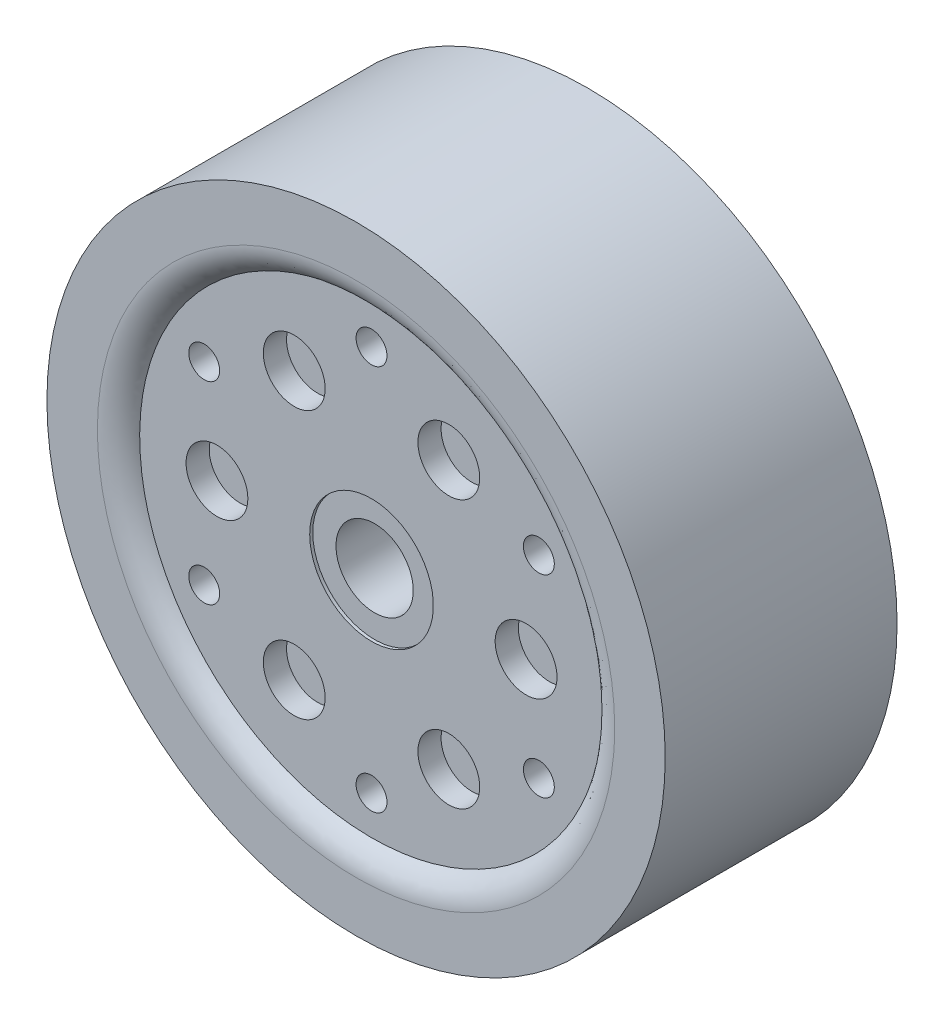
from build123d import *

# Parameters (mm, degrees)
ESQUISSE1_R             = 20
ESQUISSE1_R_2           = 17
ESQUISSE1_R_3           = 15
BOSS_EXTRU_1_DEPTH      = 7.5
ESQUISSE1_3_R           = 15
ESQUISSE1_3_R_2         = 4
BOSS_EXTRU_2_DEPTH      = 6.5
ESQUISSE1_6_R           = 4
ESQUISSE1_6_R_2         = 2.5
BOSS_EXTRU_3_DEPTH      = 6.3
CONG_1_R                = 2
ESQUISSE4_R             = 2
ENL_V_MAT_EXTRU_1_DEPTH = 1.5
ESQUISSE3_R             = 1
ENL_V_MAT_EXTRU_2_DEPTH = 7.5
CONG_1_OF_SYM_TRIE1_R   = 2


with BuildPart() as part:
    # Esquisse1 → Boss.-Extru.1 (new body)
    # profile 1 of 2: a face of its own
    with BuildSketch(Plane.XY):
        Circle(ESQUISSE1_R)
        Circle(ESQUISSE1_R_2, mode=Mode.SUBTRACT)
    # profile 2 of 2: a face of its own
    with BuildSketch(Plane.XY):
        Circle(ESQUISSE1_R_2)
        Circle(ESQUISSE1_R_3, mode=Mode.SUBTRACT)
    boss_extru_1 = extrude(amount=BOSS_EXTRU_1_DEPTH)

    # Esquisse1<3> → Boss.-Extru.2 (add)
    with BuildSketch(Plane.XY):
        Circle(ESQUISSE1_3_R)
        with Locations(Location((0, 0, 0), (0, 0, 180))):
            Circle(ESQUISSE1_3_R_2, mode=Mode.SUBTRACT)
    boss_extru_2 = extrude(amount=BOSS_EXTRU_2_DEPTH)

    # Esquisse1<6> → Boss.-Extru.3 (add)
    with BuildSketch(Plane.XY):
        with Locations(Location((0, 0, 0), (0, 0, 180))):
            Circle(ESQUISSE1_6_R)
        Circle(ESQUISSE1_6_R_2, mode=Mode.SUBTRACT)
    boss_extru_3 = extrude(amount=BOSS_EXTRU_3_DEPTH)

    # Congé1
    # the kernel refuses this fillet: 2 mm, written as the material it takes off along each edge
    with BuildSketch(Plane(origin=(0, 0, 7.5), x_dir=(1, 0, 0), z_dir=(0, -1, 0))) as cong_1_piece_1:
        with BuildLine():
            CenterArc((16.732050808, -2), CONG_1_R, 90, 60)
            Line((15, -1), (14.965358984, -0.98))
            ThreePointArc((14.965358984, -0.98), (14.96, -0.5), (14.96, 0))
            Line((14.96, 0), (15, 0.04))
            Line((15, 0.04), (16.732050808, 0.04))
            Line((16.732050808, 0.04), (16.732050808, 0))
        make_face()
    revolve(axis=Axis((0, 0, 7.5), (0, 0, 1)), mode=Mode.SUBTRACT)

    # Esquisse4 → Enlèv. mat.-Extru.1 (cut)
    with BuildSketch(Plane.XY.offset(6.5)):
        with Locations((-10, 0)):
            Circle(ESQUISSE4_R)
        with Locations((-5, 8.660254038)):
            Circle(ESQUISSE4_R)
        with Locations((5, 8.660254038)):
            Circle(ESQUISSE4_R)
        with Locations((10, 0)):
            Circle(ESQUISSE4_R)
        with Locations((5, -8.660254038)):
            Circle(ESQUISSE4_R)
        with Locations((-5, -8.660254038)):
            Circle(ESQUISSE4_R)
    enl_v_mat_extru_1 = extrude(amount=-ENL_V_MAT_EXTRU_1_DEPTH, mode=Mode.SUBTRACT)

    # Esquisse3 → Enlèv. mat.-Extru.2 (cut)
    with BuildSketch(Plane.XY.offset(6.5)):
        with Locations((0, 12.5)):
            Circle(ESQUISSE3_R)
        with Locations((-10.825317547, 6.25)):
            Circle(ESQUISSE3_R)
        with Locations((-10.825317547, -6.25)):
            Circle(ESQUISSE3_R)
        with Locations((0, -12.5)):
            Circle(ESQUISSE3_R)
        with Locations((10.825317547, -6.25)):
            Circle(ESQUISSE3_R)
        with Locations((10.825317547, 6.25)):
            Circle(ESQUISSE3_R)
    enl_v_mat_extru_2 = extrude(amount=-ENL_V_MAT_EXTRU_2_DEPTH, mode=Mode.SUBTRACT)

    # Symétrie1: Boss.-Extru.1, Boss.-Extru.2, Boss.-Extru.3, Enlèv. mat.-Extru.1, Enlèv. mat.-Extru.2 across plane
    add(boss_extru_1.mirror(Plane.XY))
    add(boss_extru_2.mirror(Plane.XY))
    add(boss_extru_3.mirror(Plane.XY))
    add(enl_v_mat_extru_1.mirror(Plane.XY), mode=Mode.SUBTRACT)
    add(enl_v_mat_extru_2.mirror(Plane.XY), mode=Mode.SUBTRACT)

    # Congé1 of Symétrie1
    # the kernel refuses this fillet: 2 mm, written as the material it takes off along each edge
    with BuildSketch(Plane(origin=(0, 0, -7.5), x_dir=(1, 0, 0), z_dir=(0, -1, 0))) as cong_1_of_sym_trie1_piece_1:
        with BuildLine():
            CenterArc((16.732050808, 2), CONG_1_OF_SYM_TRIE1_R, 210, 60)
            Line((15, 1), (14.965358984, 0.98))
            ThreePointArc((14.965358984, 0.98), (14.96, 0.5), (14.96, 0))
            Line((14.96, 0), (15, -0.04))
            Line((15, -0.04), (16.732050808, -0.04))
            Line((16.732050808, -0.04), (16.732050808, 0))
        make_face()
    revolve(axis=Axis((0, 0, -7.5), (0, 0, 1)), mode=Mode.SUBTRACT)


solid = part.part
